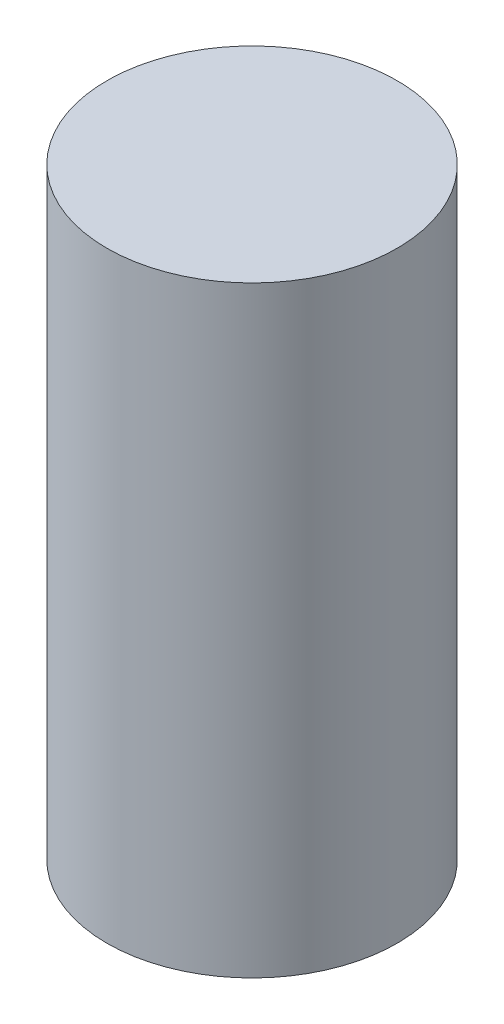
from build123d import *

# Parameters (mm, degrees)
SKETCH1_R           = 3
BOSS_EXTRUDE1_DEPTH = 12.44


with BuildPart() as part:
    # Sketch1 → Boss-Extrude1 (new body)
    with BuildSketch(Plane(origin=(0, 0, 0), x_dir=(1, 0, 0), z_dir=(0, 1, 0))):
        Circle(SKETCH1_R)
    extrude(amount=BOSS_EXTRUDE1_DEPTH)


solid = part.part
